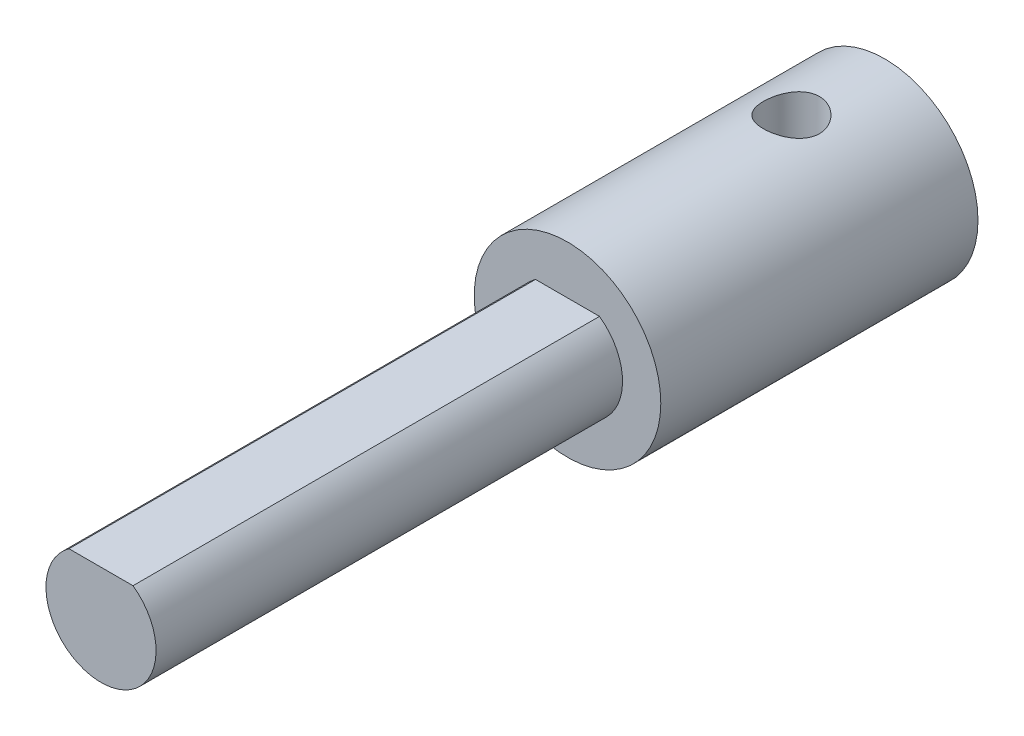
from build123d import *

# Parameters (mm, degrees)
SKETCH1_R           = 5
BOSS_EXTRUDE1_DEPTH = 15
CUT_EXTRUDE1_REACH  = 18.583
SKETCH3_R           = 1.5
SKETCH4_R           = 5
BOSS_EXTRUDE2_DEPTH = 2
BOSS_EXTRUDE3_DEPTH = 25


with BuildPart() as part:
    # Sketch1 → Boss-Extrude1 (new body)
    with BuildSketch(Plane.XY):
        Circle(SKETCH1_R)
        with BuildLine():
            Line((-1.656238208, 2.65), (1.656238208, 2.65))
            ThreePointArc((1.656238208, 2.65), (0, -3.125), (-1.656238208, 2.65))
        make_face(mode=Mode.SUBTRACT)
    extrude(amount=BOSS_EXTRUDE1_DEPTH)

    # Sketch3 → Cut-Extrude1 (cut, up to next)
    with BuildSketch(Plane(origin=(0, 0, 0), x_dir=(1, 0, 0), z_dir=(0, 1, 0)), mode=Mode.PRIVATE) as cut_extrude1_sk1:
        with Locations((0, -5)):
            Circle(SKETCH3_R)
    cut_extrude1_tool1 = extrude(cut_extrude1_sk1.sketch, amount=CUT_EXTRUDE1_REACH, mode=Mode.PRIVATE) & part.part
    add(cut_extrude1_tool1.solids().sort_by_distance((0, 0, 5))[0], mode=Mode.SUBTRACT)

    # Sketch4 → Boss-Extrude2 (add)
    with BuildSketch(Plane.XY.offset(15)):
        Circle(SKETCH4_R)
    extrude(amount=BOSS_EXTRUDE2_DEPTH)

    # Sketch6 → Boss-Extrude3 (add)
    with BuildSketch(Plane.XY.offset(17)):
        with BuildLine():
            Line((1.71537168, 2.4), (-1.71537168, 2.4))
            ThreePointArc((-1.71537168, 2.4), (-1.349472776, -2.623246696), (2.95, 0))
            ThreePointArc((2.95, 0), (2.623246696, 1.349472776), (1.71537168, 2.4))
        make_face()
    extrude(amount=BOSS_EXTRUDE3_DEPTH)


solid = part.part
